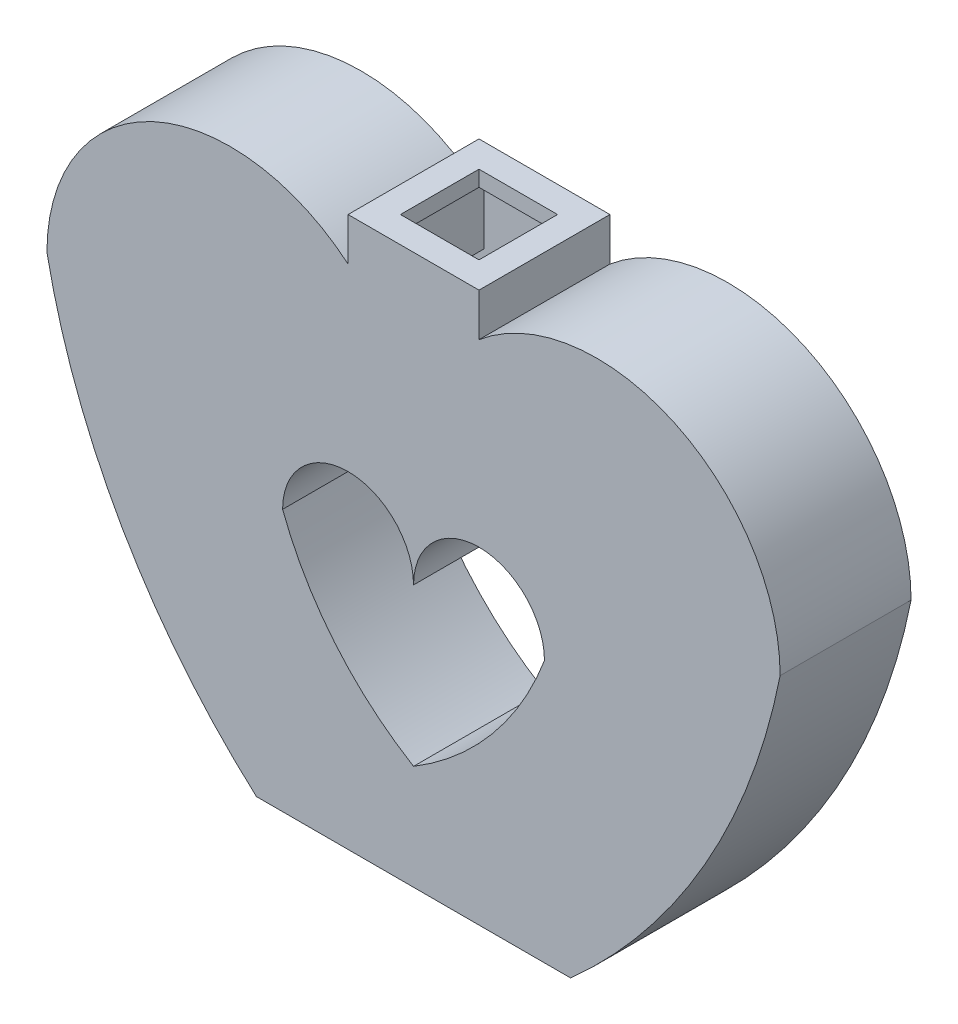
from build123d import *

# Parameters (mm, degrees)
SALIENTE_EXTRUIR1_DEPTH = 25
CORTAR_EXTRUIR1_DEPTH   = 25
CROQUIS5_W              = 25
CROQUIS5_H              = 25
SALIENTE_EXTRUIR2_DEPTH = 35
VACIADO14_START         = 2
VACIADO14_DEPTH         = 18
CROQUIS14_W             = 15
CROQUIS14_H             = 15
CORTAR_EXTRUIR3_DEPTH   = 37


# Read off the part's stored shape, not the designer's step: Vaciado14
with BuildPart() as part:
    # Croquis1 → Saliente-Extruir1 (new body)
    with BuildSketch(Plane.XY):
        with BuildLine():
            Line((0, 0), (30, 0))
            ThreePointArc((30, 0), (55.704345855, 31.740373797), (70, 70))
            ThreePointArc((70, 70), (49.790199458, 101.721443851), (12.5, 96.809513237))
            Line((12.5, 96.809513237), (12.5, 70))
            Line((12.5, 70), (0, 70))
            Line((0, 70), (-12.5, 70))
            Line((-12.5, 70), (-12.5, 96.809513237))
            ThreePointArc((-12.5, 96.809513237), (-49.790199458, 101.721443851), (-70, 70))
            ThreePointArc((-70, 70), (-55.704345855, 31.740373797), (-30, 0))
            Line((-30, 0), (0, 0))
        make_face()
    extrude(amount=SALIENTE_EXTRUIR1_DEPTH)

    # Croquis2 → Cortar-Extruir1 (cut)
    with BuildSketch(Plane.XY):
        with BuildLine():
            ThreePointArc((25, 50), (12.5, 62.5), (0, 50))
            ThreePointArc((0, 50), (-12.5, 62.5), (-25, 50))
            ThreePointArc((-25, 50), (-15.02993221, 32.891723159), (0, 20))
            ThreePointArc((0, 20), (15.02993221, 32.891723159), (25, 50))
        make_face()
    extrude(amount=CORTAR_EXTRUIR1_DEPTH, mode=Mode.SUBTRACT)

    # Croquis5 → Saliente-Extruir2 (add)
    with BuildSketch(Plane(origin=(0, 70, 0), x_dir=(1, 0, 0), z_dir=(0, 1, 0))):
        with Locations((0, -12.5)):
            Rectangle(CROQUIS5_W, CROQUIS5_H)
    extrude(amount=SALIENTE_EXTRUIR2_DEPTH)

    # Vaciado14 outline → Vaciado14 (cut)
    with BuildSketch(Plane.XY.offset(VACIADO14_START)):
        with BuildLine():
            Line((-28.84831613, 3), (25.844637923, 3))
            ThreePointArc((25.844637923, 3), (52.641551282, 36.515307349), (66.170757203, 77.237671959))
            ThreePointArc((66.170757203, 77.237671959), (41.679167851, 101.2951868), (9.5, 89.332614929))
            Line((9.5, 89.332614929), (9.5, 102))
            Line((9.5, 102), (-9.5, 102))
            Line((-9.5, 102), (-9.5, 89.332614929))
            ThreePointArc((-9.5, 89.332614929), (-45.060390177, 100.377434873), (-66.998683941, 70.290217258))
            ThreePointArc((-66.998683941, 70.290217258), (-53.306904817, 33.592972957), (-28.84831613, 3))
        make_face()
        with BuildLine():
            ThreePointArc((0, 59.16515139), (17.591066798, 64.640049141), (27.989581723, 49.43179402))
            ThreePointArc((27.989581723, 49.43179402), (16.926348915, 30.486291666), (0, 16.528287079))
            ThreePointArc((0, 16.528287079), (-16.926348915, 30.486291666), (-27.989581723, 49.43179402))
            ThreePointArc((-27.989581723, 49.43179402), (-17.591066798, 64.640049141), (0, 59.16515139))
        make_face(mode=Mode.SUBTRACT)
    extrude(amount=VACIADO14_DEPTH, mode=Mode.SUBTRACT)

    # Croquis14 → Cortar-Extruir3 (cut)
    with BuildSketch(Plane(origin=(0, 120, 0), x_dir=(1, 0, 0), z_dir=(0, 1, 0))):
        with Locations((0, -12.5)):
            Rectangle(CROQUIS14_W, CROQUIS14_H)
    extrude(amount=-CORTAR_EXTRUIR3_DEPTH, mode=Mode.SUBTRACT)


solid = part.part
